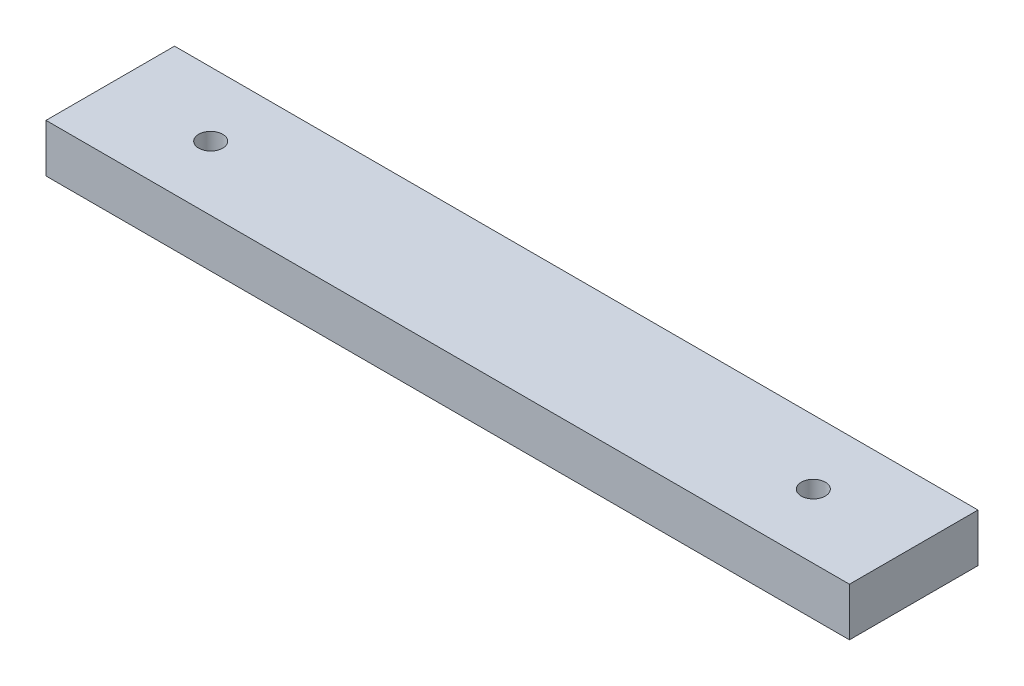
from build123d import *

# Parameters (mm, degrees)
SKETCH_1_W      = 100
SKETCH_1_H      = 16
SKETCH_1_R      = 1.5
EXTRUDE_1_DEPTH = 6


with BuildPart() as part:
    # 草圖1 → 填料-伸長1 (new body)
    with BuildSketch(Plane(origin=(0, 0, 0), x_dir=(1, 0, 0), z_dir=(0, 1, 0))):
        Rectangle(SKETCH_1_W, SKETCH_1_H)
        with Locations((-37.5, 0)):
            Circle(SKETCH_1_R, mode=Mode.SUBTRACT)
        with Locations((37.5, 0)):
            Circle(SKETCH_1_R, mode=Mode.SUBTRACT)
    extrude(amount=EXTRUDE_1_DEPTH)


solid = part.part
